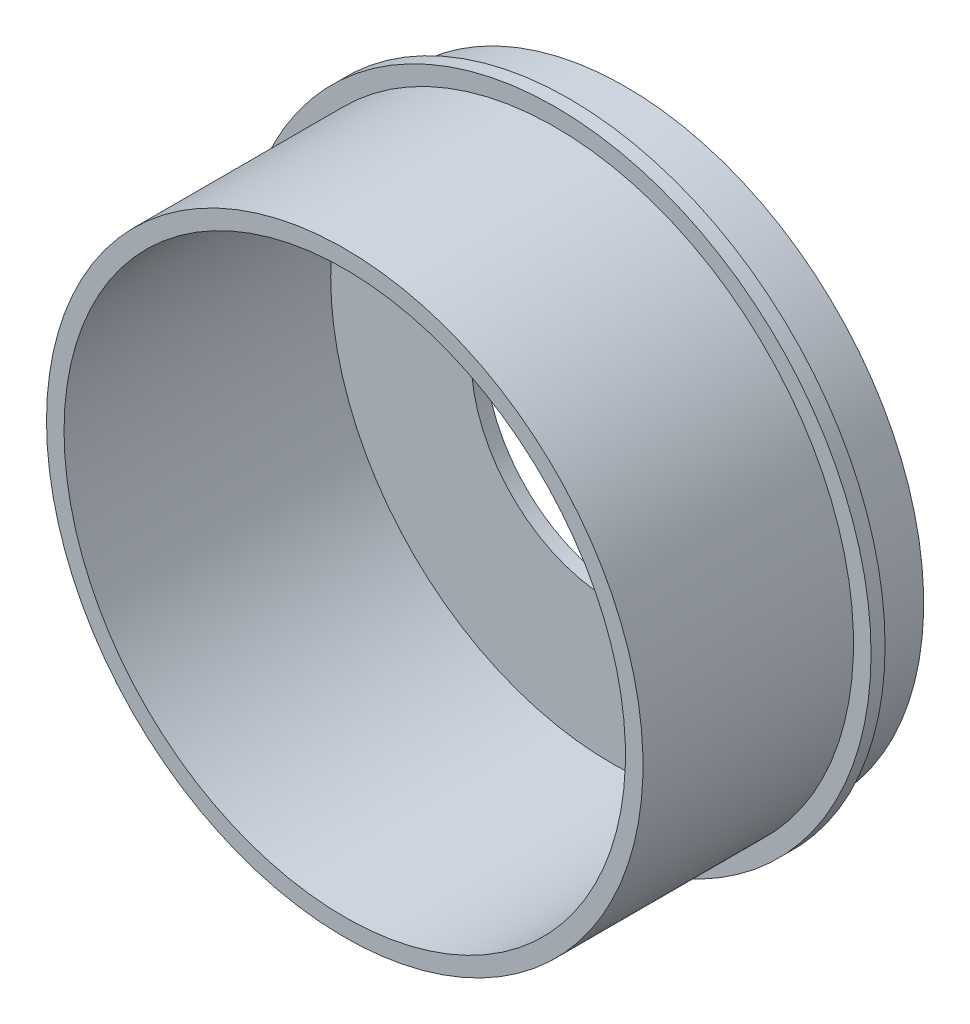
from build123d import *


with BuildPart() as part:
    # Sketch6 → Revolve1 (revolve)
    with BuildSketch(Plane(origin=(0, 0, 0), x_dir=(0, 0, -1), z_dir=(1, 0, 0))):
        Polygon((0, 25.4), (-2.54, 25.4), (-2.54, 50.8), (-50.8, 50.8), (-50.8, 53.975), (-12.7, 53.975), (-12.7, 57.15), (-10.16, 57.15), (-10.16, 53.975), (0, 53.975), align=None)
    revolve(axis=Axis((0, 0, 0), (0, 0, 1)))


solid = part.part
